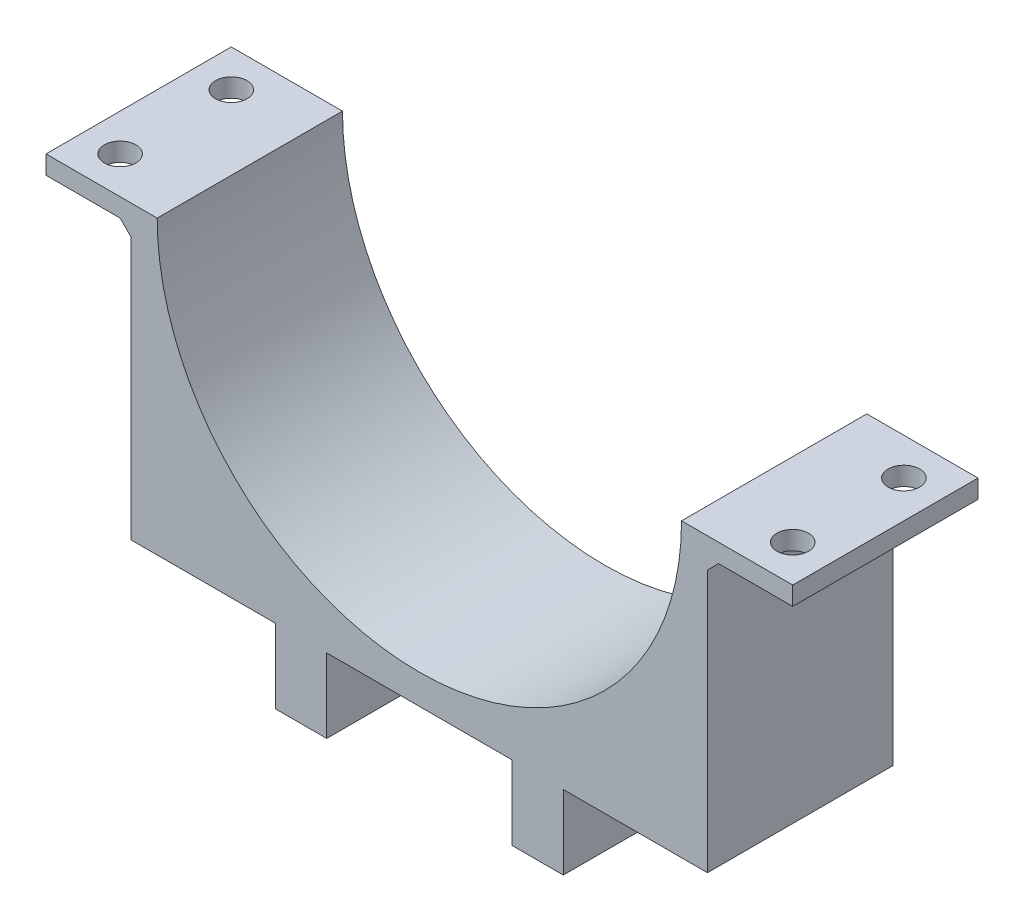
from build123d import *

# Parameters (mm, degrees)
DODANIE_WYCI_GNI_CIE1_DEPTH = 50
SZKIC2_R                    = 4.25
WYTNIJ_WYCI_GNI_CIE1_DEPTH  = 21
SFAZOWANIE1_SIZE            = 3
SFAZOWANIE2_SIZE            = 3


with BuildPart() as part:
    # Szkic1 → Dodanie-wyciągnięcie1 (new body)
    with BuildSketch(Plane.XY):
        with BuildLine():
            Line((70.75, 0), (100.75, 0))
            Line((100.75, 0), (100.75, -5))
            Line((100.75, -5), (77.75, -5))
            Line((77.75, -5), (77.75, -78.737292332))
            Line((77.75, -78.737292332), (38.85, -78.737292332))
            Line((38.85, -78.737292332), (38.85, -98.737292332))
            Line((38.85, -98.737292332), (25, -98.737292332))
            Line((25, -98.737292332), (25, -78.737292332))
            Line((25, -78.737292332), (-25, -78.737292332))
            Line((-25, -78.737292332), (-25, -98.737292332))
            Line((-25, -98.737292332), (-38.85, -98.737292332))
            Line((-38.85, -98.737292332), (-38.85, -78.737292332))
            Line((-38.85, -78.737292332), (-77.75, -78.737292332))
            Line((-77.75, -78.737292332), (-77.75, -5))
            Line((-77.75, -5), (-100.75, -5))
            Line((-100.75, -5), (-100.75, 0))
            Line((-100.75, 0), (-70.75, 0))
            ThreePointArc((-70.75, 0), (0, -70.75), (70.75, 0))
        make_face()
    extrude(amount=DODANIE_WYCI_GNI_CIE1_DEPTH)

    # Szkic2 → Wytnij-wyciągnięcie1 (cut)
    with BuildSketch(Plane(origin=(0, 0, 0), x_dir=(1, 0, 0), z_dir=(0, 1, 0))):
        with Locations((-90.75, -10)):
            Circle(SZKIC2_R)
        with Locations((-90.75, -40)):
            Circle(SZKIC2_R)
    wytnij_wyci_gni_cie1 = extrude(amount=-WYTNIJ_WYCI_GNI_CIE1_DEPTH, mode=Mode.SUBTRACT)

    # Lustro2: Wytnij-wyciągnięcie1 across plane
    add(wytnij_wyci_gni_cie1.mirror(Plane(origin=(0, 0, 0), x_dir=(0, 0, 1), z_dir=(1, 0, 0))), mode=Mode.SUBTRACT)

    # Sfazowanie1
    sfazowanie1_edges = [part.edges().sort_by_distance(p)[0] for p in [
        (-77.75, -5, 25),
    ]]
    chamfer(sfazowanie1_edges, length=SFAZOWANIE1_SIZE)

    # Sfazowanie2
    sfazowanie2_edges = [part.edges().sort_by_distance(p)[0] for p in [
        (77.75, -5, 25),
    ]]
    chamfer(sfazowanie2_edges, length=SFAZOWANIE2_SIZE)


solid = part.part
